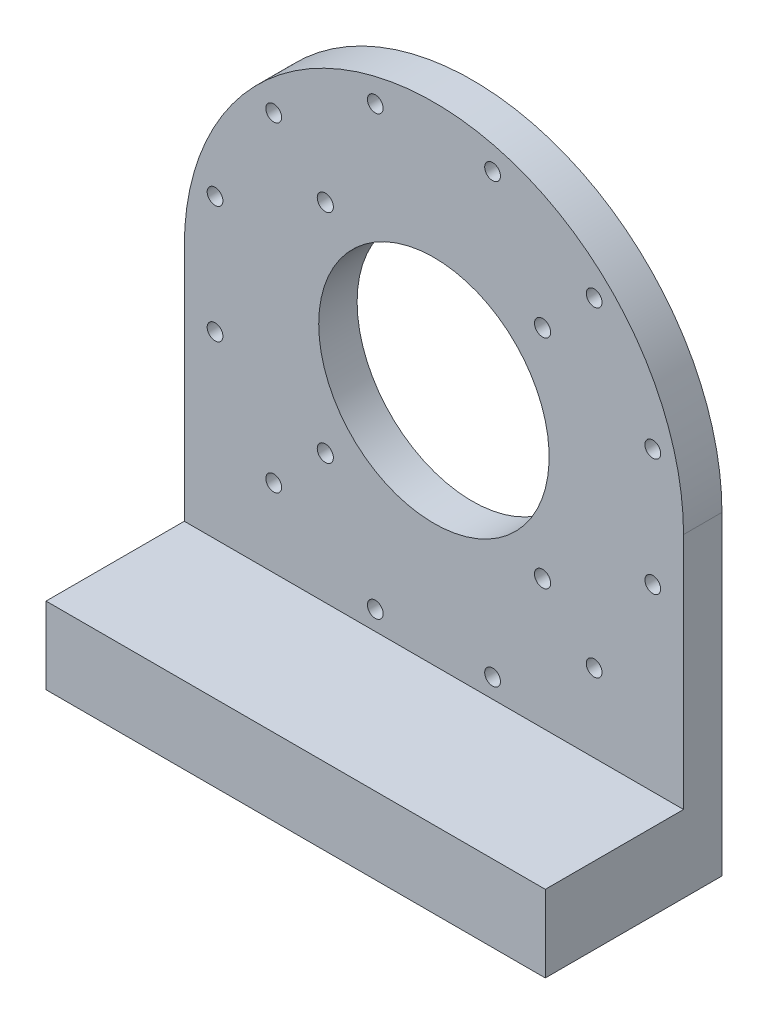
from build123d import *

# Parameters (mm, degrees)
SKETCH1_R           = 1.575
SKETCH1_R_2         = 2.1
SKETCH1_R_3         = 15
BOSS_EXTRUDE1_DEPTH = 10
SKETCH1_3_W         = 130
SKETCH1_3_H         = 20
BOSS_EXTRUDE2_DEPTH = 36
SKETCH2_R           = 30
CUT_EXTRUDE1_DEPTH  = 36
SKETCH4_R           = 2.05
CUT_EXTRUDE2_DEPTH  = 197.103143987


with BuildPart() as part:
    # Sketch1 → Boss-Extrude1 (new body)
    with BuildSketch(Plane(origin=(0, 0, -97.507071393), x_dir=(-1, 0, 0), z_dir=(0, 0, -1))):
        with BuildLine():
            ThreePointArc((-24.072792821, 47.25870832), (-89.072792821, 112.25870832), (-154.072792821, 47.25870832))
            Line((-154.072792821, 47.25870832), (-154.072792821, -34.74129168))
            Line((-154.072792821, -34.74129168), (-24.072792821, -34.74129168))
            Line((-24.072792821, -34.74129168), (-24.072792821, 47.25870832))
        make_face()
        with Locations((-32.08316907, 62.529031982)):
            Circle(SKETCH1_R, mode=Mode.SUBTRACT)
        with Locations((-60.788521574, 75.542979568)):
            Circle(SKETCH1_R_2, mode=Mode.SUBTRACT)
        with Locations((-73.80246916, 104.248332072)):
            Circle(SKETCH1_R, mode=Mode.SUBTRACT)
        with Locations((-47.353492731, 88.978008411)):
            Circle(SKETCH1_R, mode=Mode.SUBTRACT)
        with Locations((-104.343116482, -9.730915431)):
            Circle(SKETCH1_R, mode=Mode.SUBTRACT)
        with Locations((-130.792092911, 5.53940823)):
            Circle(SKETCH1_R, mode=Mode.SUBTRACT)
        with Locations((-146.062416572, 31.988384659)):
            Circle(SKETCH1_R, mode=Mode.SUBTRACT)
        with Locations((-117.357064069, 18.974437073)):
            Circle(SKETCH1_R_2, mode=Mode.SUBTRACT)
        with Locations((-73.80246916, -9.730915431)):
            Circle(SKETCH1_R, mode=Mode.SUBTRACT)
        with Locations((-60.788521574, 18.974437073)):
            Circle(SKETCH1_R_2, mode=Mode.SUBTRACT)
        with Locations((-47.353492731, 5.53940823)):
            Circle(SKETCH1_R, mode=Mode.SUBTRACT)
        with Locations((-32.08316907, 31.988384659)):
            Circle(SKETCH1_R, mode=Mode.SUBTRACT)
        with Locations((-146.062416572, 62.529031982)):
            Circle(SKETCH1_R, mode=Mode.SUBTRACT)
        with Locations((-89.072792821, 47.25870832)):
            Circle(SKETCH1_R_3, mode=Mode.SUBTRACT)
        with Locations((-130.792092911, 88.978008411)):
            Circle(SKETCH1_R, mode=Mode.SUBTRACT)
        with Locations((-117.357064069, 75.542979568)):
            Circle(SKETCH1_R_2, mode=Mode.SUBTRACT)
        with Locations((-104.343116482, 104.248332072)):
            Circle(SKETCH1_R, mode=Mode.SUBTRACT)
    extrude(amount=BOSS_EXTRUDE1_DEPTH)

    # Sketch1<3> → Boss-Extrude2 (add)
    with BuildSketch(Plane(origin=(0, 0, -97.507071393), x_dir=(-1, 0, 0), z_dir=(0, 0, -1))):
        with Locations((-89.072792821, -24.74129168)):
            Rectangle(SKETCH1_3_W, SKETCH1_3_H)
    extrude(amount=-BOSS_EXTRUDE2_DEPTH)

    # Sketch2 → Cut-Extrude1 (cut)
    with BuildSketch(Plane(origin=(0, 0, -107.507071393), x_dir=(-1, 0, 0), z_dir=(0, 0, -1))):
        with Locations((-89.072792821, 47.25870832)):
            Circle(SKETCH2_R)
    extrude(amount=-CUT_EXTRUDE1_DEPTH, mode=Mode.SUBTRACT)

    # Sketch4 → Cut-Extrude2 (cut, through all)
    with BuildSketch(Plane(origin=(0, 0, -107.507071393), x_dir=(-1, 0, 0), z_dir=(0, 0, -1))):
        with Locations((-73.80246916, 104.248332072)):
            Circle(SKETCH4_R)
        with Locations((-47.353492731, 88.978008411)):
            Circle(SKETCH4_R)
        with Locations((-32.08316907, 62.529031982)):
            Circle(SKETCH4_R)
        with Locations((-32.08316907, 31.988384659)):
            Circle(SKETCH4_R)
        with Locations((-47.353492731, 5.53940823)):
            Circle(SKETCH4_R)
        with Locations((-73.80246916, -9.730915431)):
            Circle(SKETCH4_R)
        with Locations((-104.343116482, -9.730915431)):
            Circle(SKETCH4_R)
        with Locations((-130.792092911, 5.53940823)):
            Circle(SKETCH4_R)
        with Locations((-146.062416572, 31.988384659)):
            Circle(SKETCH4_R)
        with Locations((-146.062416572, 62.529031982)):
            Circle(SKETCH4_R)
        with Locations((-130.792092911, 88.978008411)):
            Circle(SKETCH4_R)
        with Locations((-104.343116482, 104.248332072)):
            Circle(SKETCH4_R)
    extrude(amount=-CUT_EXTRUDE2_DEPTH, mode=Mode.SUBTRACT)


solid = part.part
